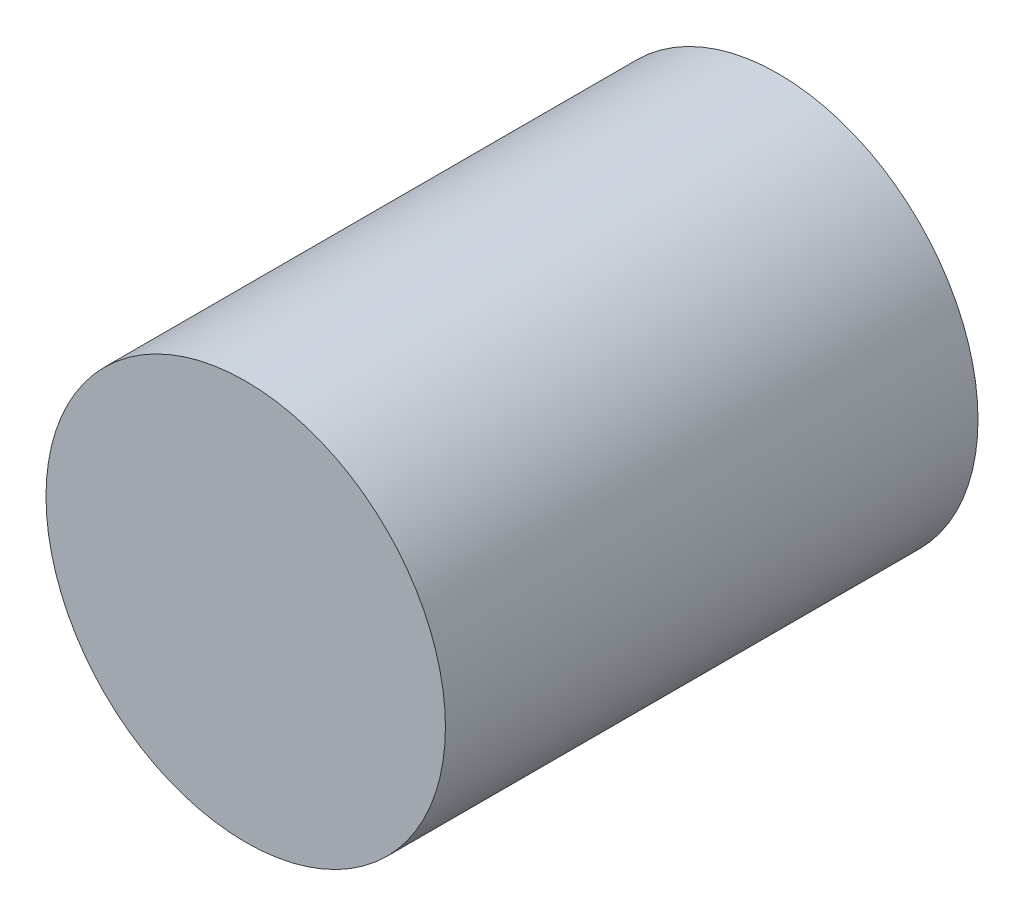
from build123d import *

# Parameters (mm, degrees)
SKETCH1_R           = 15
BOSS_EXTRUDE1_DEPTH = 40


with BuildPart() as part:
    # Sketch1 → Boss-Extrude1 (new body)
    with BuildSketch(Plane.XY):
        Circle(SKETCH1_R)
    extrude(amount=BOSS_EXTRUDE1_DEPTH)


solid = part.part
